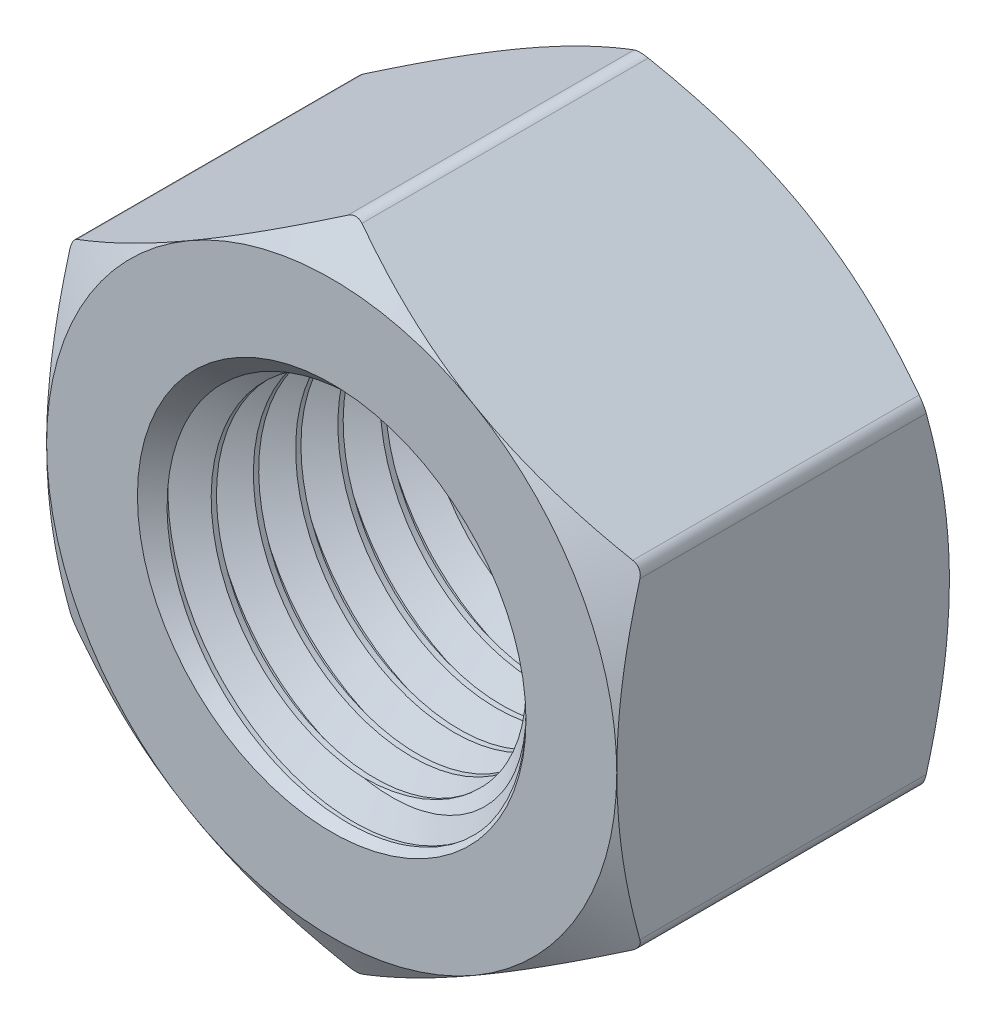
from build123d import *

# Parameters (mm, degrees)
BOSS_EXTRUDE2_DEPTH     = 4.1671875
CUT_EXTRUDE4_DEPTH      = 12.680874731
CUT_EXTRUDE4_DEPTH_BACK = 12.680874731
SKETCH16_R              = 4.7625
SKETCH7_OUTSIDE_W       = 71.99
SKETCH7_OUTSIDE_H       = 74.2
SKETCH7_OUTSIDE_R       = 7.14375
CUT_EXTRUDE5_DEPTH      = 14.730957339
CUT_EXTRUDE5_DRAFT      = -60
MIRROR4_COPY_1_SKETCH_W = 71.99
MIRROR4_COPY_1_SKETCH_H = 74.2
MIRROR4_COPY_1_SKETCH_R = 7.14375
MIRROR4_COPY_1_DEPTH    = 14.730957339
MIRROR4_COPY_1_DRAFT    = -60
FILLET2_R               = 0.3571875
SKETCH13_R              = 4.7625
BOSS_EXTRUDE1_DEPTH     = 8.334375
CUT_SWEEP1_PITCH        = 1.058333333
SKETCH17_R              = 4.7625
BOSS_EXTRUDE3_DEPTH     = 8.334375


with BuildPart() as part:
    # Sketch15 → Boss-Extrude2 (new, symmetric)
    with BuildSketch(Plane.XY):
        Polygon((0, 8.248891971), (-7.14375, 4.124445986), (-7.14375, -4.124445986), (0, -8.248891971), (7.14375, -4.124445986), (7.14375, 4.124445986), align=None)
    extrude(amount=BOSS_EXTRUDE2_DEPTH, both=True)

    # Sketch16 → Cut-Extrude4 (cut, two sides: drawn at the far end of the back side and taken through both)
    with BuildSketch(Plane.XY.offset(-CUT_EXTRUDE4_DEPTH_BACK)):
        Circle(SKETCH16_R)
    extrude(amount=CUT_EXTRUDE4_DEPTH + CUT_EXTRUDE4_DEPTH_BACK, mode=Mode.SUBTRACT)


with BuildPart() as cut_extrude5_tool:
    # Sketch7 outside → Cut-Extrude5 (with draft: the straight prism first)
    with BuildSketch(Plane.XY.offset(4.1671875)):
        Rectangle(SKETCH7_OUTSIDE_W, SKETCH7_OUTSIDE_H)
        Circle(SKETCH7_OUTSIDE_R, mode=Mode.SUBTRACT)
    extrude(amount=-CUT_EXTRUDE5_DEPTH)
    # Cut-Extrude5: the draft: its side faces are tilted about the plane it starts from
    cut_extrude5_sides = [cut_extrude5_tool.faces().sort_by_distance(p)[0] for p in [
        (0, -37.1, -3.19829117),
        (35.995, 0, -3.19829117),
        (0, 37.1, -3.19829117),
        (-35.995, 0, -3.19829117),
        (-7.14375, 0, -3.19829117),
    ]]
    draft(cut_extrude5_sides, Plane.XY.offset(4.1671875), CUT_EXTRUDE5_DRAFT)


with BuildPart() as part_1:
    add(part.part)

    # Cut-Extrude5: cut by cut_extrude5_tool
    add(cut_extrude5_tool.part, mode=Mode.SUBTRACT)


with BuildPart() as mirror4_copy_1_tool:
    # Mirror4 copy 1 sketch → Mirror4 copy 1 (with draft: the straight prism first)
    with BuildSketch(Plane(origin=(0, 0, -4.1671875), x_dir=(1, 0, 0), z_dir=(0, 0, -1))):
        Rectangle(MIRROR4_COPY_1_SKETCH_W, MIRROR4_COPY_1_SKETCH_H)
        Circle(MIRROR4_COPY_1_SKETCH_R, mode=Mode.SUBTRACT)
    extrude(amount=-MIRROR4_COPY_1_DEPTH)
    # Mirror4 copy 1: the draft: its side faces are tilted about the plane it starts from
    mirror4_copy_1_sides = [mirror4_copy_1_tool.faces().sort_by_distance(p)[0] for p in [
        (0, -37.1, 3.19829117),
        (35.995, 0, 3.19829117),
        (0, 37.1, 3.19829117),
        (-35.995, 0, 3.19829117),
        (-7.14375, 0, 3.19829117),
    ]]
    draft(mirror4_copy_1_sides, Plane(origin=(0, 0, -4.1671875), x_dir=(1, 0, 0), z_dir=(0, 0, -1)), MIRROR4_COPY_1_DRAFT)


with BuildPart() as part_2:
    add(part_1.part)

    # Mirror4 copy 1: cut by mirror4_copy_1_tool
    add(mirror4_copy_1_tool.part, mode=Mode.SUBTRACT)

    # Fillet2
    fillet2_edges = [part_2.edges().sort_by_distance(p)[0] for p in [
        (-7.14375, 4.124445986, 0),
        (-7.14375, -4.124445986, 0),
        (0, -8.248891971, 0),
        (7.14375, -4.124445986, 0),
        (7.14375, 4.124445986, 0),
        (0, 8.248891971, 0),
    ]]
    fillet(fillet2_edges, radius=FILLET2_R)

    # Sketch17 → Boss-Extrude3 (add)
    with BuildSketch(Plane.XY.offset(4.1671875)):
        Circle(SKETCH17_R)
    extrude(amount=-BOSS_EXTRUDE3_DEPTH)


with BuildPart() as body_2:
    # Sketch13 → Boss-Extrude1 (new body)
    with BuildSketch(Plane(origin=(0, 0, -4.1671875), x_dir=(-1, 0, 0), z_dir=(0, 0, -1))):
        Circle(SKETCH13_R)
    extrude(amount=-BOSS_EXTRUDE1_DEPTH)

    # Cut-Sweep1: the profile of Sketch12 profile screwed along a right-hand helix of 8.875 turns, 8 arcs to a turn; built about Z, then put on its axis
    cut_sweep1_z = Axis((0, 0, 0), (0, 0, 1))
    cut_sweep1_corners = [(4.7628, 0, -0.926214872), (4.7628, 0, 0.000173205), (4.075092336, 0, -0.396875), (4.075092336, 0, -0.529166667)]
    with BuildLine(mode=Mode.PRIVATE) as cut_sweep1_profile:
        Line(cut_sweep1_corners[0], cut_sweep1_corners[1])
        Line(cut_sweep1_corners[1], cut_sweep1_corners[2])
        Line(cut_sweep1_corners[2], cut_sweep1_corners[3])
        Line(cut_sweep1_corners[3], cut_sweep1_corners[0])
    cut_sweep1_cap = Face(cut_sweep1_profile.wire())
    cut_sweep1_turn_angles = [0, 22.5, 45, 67.5, 90, 112.5, 135, 157.5, 180, 202.5, 225, 247.5, 270, 292.5, 315, 337.5, 360]
    cut_sweep1_turn_weights = [1, 0.9238795325112867, 1, 0.9238795325112867, 1, 0.9238795325112867, 1, 0.9238795325112867, 1, 0.9238795325112867, 1, 0.9238795325112867, 1, 0.9238795325112867, 1, 0.9238795325112867, 1]
    cut_sweep1_turn_rails = [Edge.make_bspline([Vector(p[0], p[1], 0).rotate(cut_sweep1_z, cut_sweep1_turn_angles[k]) / cut_sweep1_turn_weights[k] + Vector(0, 0, p[2] + CUT_SWEEP1_PITCH * cut_sweep1_turn_angles[k] / 360) for k in range(17)], [0, 0, 0, 1, 1, 2, 2, 3, 3, 4, 4, 5, 5, 6, 6, 7, 7, 8, 8, 8], 2, cut_sweep1_turn_weights) for p in cut_sweep1_corners]
    cut_sweep1_turn_sides = [Face.make_surface_from_curves(cut_sweep1_turn_rails[p[0]], cut_sweep1_turn_rails[p[1]]) for p in [(0, 1), (1, 2), (2, 3), (3, 0)]]
    cut_sweep1_last_angles = [2880, 2902.5, 2925, 2947.5, 2970, 2992.5, 3015, 3037.5, 3060, 3082.5, 3105, 3127.5, 3150, 3172.5, 3195]
    cut_sweep1_last_weights = [1, 0.9238795325112867, 1, 0.9238795325112867, 1, 0.9238795325112867, 1, 0.9238795325112867, 1, 0.9238795325112867, 1, 0.9238795325112867, 1, 0.9238795325112974, 1]
    cut_sweep1_last_rails = [Edge.make_bspline([Vector(p[0], p[1], 0).rotate(cut_sweep1_z, cut_sweep1_last_angles[k]) / cut_sweep1_last_weights[k] + Vector(0, 0, p[2] + CUT_SWEEP1_PITCH * cut_sweep1_last_angles[k] / 360) for k in range(15)], [0, 0, 0, 1, 1, 2, 2, 3, 3, 4, 4, 5, 5, 6, 6, 7, 7, 7], 2, cut_sweep1_last_weights) for p in cut_sweep1_corners]
    cut_sweep1_last_sides = [Face.make_surface_from_curves(cut_sweep1_last_rails[p[0]], cut_sweep1_last_rails[p[1]]) for p in [(0, 1), (1, 2), (2, 3), (3, 0)]]
    cut_sweep1 = Plane(origin=(0, 0, -4.1671875), x_dir=(0, 1, 0), z_dir=(0, 0, 1)) * Solid(Shell([*[p.moved(Location((0, 0, CUT_SWEEP1_PITCH * i))) for i in range(8) for p in cut_sweep1_turn_sides], *cut_sweep1_last_sides, cut_sweep1_cap, cut_sweep1_cap.rotate(cut_sweep1_z, 3195).moved(Location((0, 0, CUT_SWEEP1_PITCH * 3195 / 360)))]))
    add(cut_sweep1, mode=Mode.SUBTRACT)


with BuildPart() as part_3:
    add(part_2.part)

    # Combine1: cut body 2
    add(body_2.part, mode=Mode.SUBTRACT)

    # Cut-Extrude2 cone 1 section (through the dimple's axis) → Cut-Extrude2 (revolve, cut)
    with BuildSketch(Plane(origin=(0, 0, 4.1671875), x_dir=(0, -1, 0), z_dir=(1, 0, 0))):
        Polygon((0, 0), (4.868333333, 0), (0, 4.868333333), align=None)
    revolve(axis=Axis((0, 0, 4.1671875), (0, 0, -1)), mode=Mode.SUBTRACT)

    # Cut-Extrude3 cone 1 section (through the dimple's axis) → Cut-Extrude3 (revolve, cut)
    with BuildSketch(Plane(origin=(0, 0, -4.1671875), x_dir=(0, 1, 0), z_dir=(1, 0, 0))):
        Polygon((0, 0), (4.868333333, 0), (0, 4.868333333), align=None)
    revolve(axis=Axis((0, 0, -4.1671875), (0, 0, 1)), mode=Mode.SUBTRACT)


solid = part_3.part
